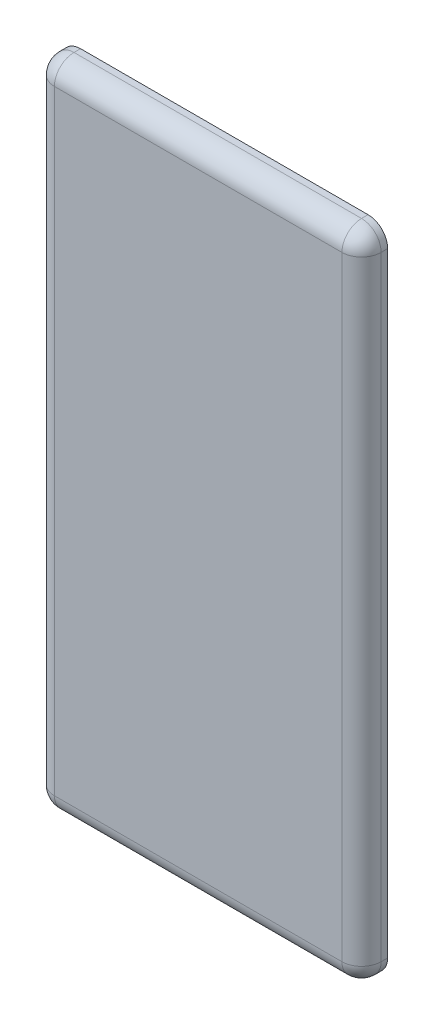
from build123d import *
from OCP.BRepFilletAPI import BRepFilletAPI_MakeChamfer

# Parameters (mm, degrees)
SKETCH1_W           = 50
SKETCH1_H           = 100
BOSS_EXTRUDE1_DEPTH = 4
FILLET1_R           = 3
FILLET2_R           = 3
SKETCH2_R           = 4.75
BOSS_EXTRUDE2_DEPTH = 10
CHAMFER1_SIZE       = 3
CHAMFER1_SIZE2      = 1.212078678


with BuildPart() as part:
    # Sketch1 → Boss-Extrude1 (new body)
    with BuildSketch(Plane.XY):
        Rectangle(SKETCH1_W, SKETCH1_H)
    extrude(amount=BOSS_EXTRUDE1_DEPTH)

    # Fillet1
    fillet1_edges = [part.edges().sort_by_distance(p)[0] for p in [
        (-25, 0, 4),
        (0, -50, 4),
        (25, 0, 4),
        (0, 50, 4),
    ]]
    fillet(fillet1_edges, radius=FILLET1_R)

    # Fillet2
    # the kernel refuses this fillet: 3 mm, written as the material it takes off along each edge
    with BuildSketch(Plane(origin=(-22, 47, 1), x_dir=(0, 1, 0), z_dir=(-1, 0, 0))) as fillet2_piece_1_section:
        Polygon((0, 0), (FILLET2_R, 0), (FILLET2_R, -FILLET2_R), (0, -FILLET2_R), align=None)
    fillet2_piece_1 = extrude(amount=FILLET2_R, mode=Mode.PRIVATE)
    fillet2_piece_1 = fillet2_piece_1 - Plane(origin=(-22, 47, 1), x_dir=(0, -0.7071067811865475, -0.7071067811865475), z_dir=(-1, 0, 0)) * Sphere(FILLET2_R, mode=Mode.PRIVATE)
    add(fillet2_piece_1, mode=Mode.SUBTRACT)
    with BuildSketch(Plane(origin=(22, 47, 1), x_dir=(0, 1, 0), z_dir=(1, 0, 0))) as fillet2_piece_2_section:
        Polygon((0, 0), (FILLET2_R, 0), (FILLET2_R, FILLET2_R), (0, FILLET2_R), align=None)
    fillet2_piece_2 = extrude(amount=FILLET2_R, mode=Mode.PRIVATE)
    fillet2_piece_2 = fillet2_piece_2 - Plane(origin=(22, 47, 1), x_dir=(0, -0.7071067811865475, -0.7071067811865475), z_dir=(1, 0, 0)) * Sphere(FILLET2_R, mode=Mode.PRIVATE)
    add(fillet2_piece_2, mode=Mode.SUBTRACT)
    with BuildSketch(Plane(origin=(-22, -47, 1), x_dir=(-1, 0, 0), z_dir=(0, -1, 0))) as fillet2_piece_3_section:
        Polygon((0, 0), (FILLET2_R, 0), (FILLET2_R, -FILLET2_R), (0, -FILLET2_R), align=None)
    fillet2_piece_3 = extrude(amount=FILLET2_R, mode=Mode.PRIVATE)
    fillet2_piece_3 = fillet2_piece_3 - Plane(origin=(-22, -47, 1), x_dir=(0.7071067811865475, 0, -0.7071067811865475), z_dir=(0, -1, 0)) * Sphere(FILLET2_R, mode=Mode.PRIVATE)
    add(fillet2_piece_3, mode=Mode.SUBTRACT)
    with BuildSketch(Plane(origin=(22, -47, 1), x_dir=(1, 0, 0), z_dir=(0, -1, 0))) as fillet2_piece_4_section:
        Polygon((0, 0), (FILLET2_R, 0), (FILLET2_R, FILLET2_R), (0, FILLET2_R), align=None)
    fillet2_piece_4 = extrude(amount=FILLET2_R, mode=Mode.PRIVATE)
    fillet2_piece_4 = fillet2_piece_4 - Plane(origin=(22, -47, 1), x_dir=(-0.7071067811865475, 0, -0.7071067811865475), z_dir=(0, -1, 0)) * Sphere(FILLET2_R, mode=Mode.PRIVATE)
    add(fillet2_piece_4, mode=Mode.SUBTRACT)
    with BuildSketch(Plane(origin=(25, -50, -7.5), x_dir=(-1, 0, 0), z_dir=(0, 0, 1)), Plane(origin=(25, 50, -7.5), x_dir=(0, -1, 0), z_dir=(0, 0, 1))) as fillet2_piece_5:
        with BuildLine():
            CenterArc((FILLET2_R, -FILLET2_R), FILLET2_R, 90, 90)
            Line((0, -FILLET2_R), (0, 0))
            Line((0, 0), (FILLET2_R, 0))
        make_face()
    extrude(amount=8.5, mode=Mode.SUBTRACT)
    with BuildSketch(Plane(origin=(-25, -50, -7.5), x_dir=(1, 0, 0), z_dir=(0, 0, 1)), Plane(origin=(-25, 50, -7.5), x_dir=(0, -1, 0), z_dir=(0, 0, 1))) as fillet2_piece_6:
        with BuildLine():
            CenterArc((FILLET2_R, FILLET2_R), FILLET2_R, 180, 90)
            Line((0, FILLET2_R), (0, 0))
            Line((0, 0), (FILLET2_R, 0))
        make_face()
    extrude(amount=8.5, mode=Mode.SUBTRACT)

    # Sketch2 → Boss-Extrude2 (add)
    with BuildSketch(Plane(origin=(0, 0, 0), x_dir=(-1, 0, 0), z_dir=(0, 0, -1))):
        with Locations((0, 25)):
            Circle(SKETCH2_R)
        with Locations((0, -25)):
            Circle(SKETCH2_R)
    extrude(amount=BOSS_EXTRUDE2_DEPTH)

    # Chamfer1: one chamfer whose edges measure the first distance from different faces: ONE call of the kernel's chamfer builder (chamfer() names one face for all edges)
    chamfer1_edges_1 = [part.edges().sort_by_distance(p)[0] for p in [
        (4.75, 25, -10),
    ]]
    chamfer1_side_1 = [part.faces().sort_by_distance(p)[0] for p in [
        (4.75, 25, -5),
    ]]
    chamfer1_edges_2 = [part.edges().sort_by_distance(p)[0] for p in [
        (4.75, -25, -10),
    ]]
    chamfer1_side_2 = [part.faces().sort_by_distance(p)[0] for p in [
        (4.75, -25, -5),
    ]]
    chamfer1 = BRepFilletAPI_MakeChamfer(part.part.solid().wrapped)
    for e in chamfer1_edges_1:
        chamfer1.Add(CHAMFER1_SIZE, CHAMFER1_SIZE2, e.wrapped, chamfer1_side_1[0].wrapped)  # the first distance lies on this face
    for e in chamfer1_edges_2:
        chamfer1.Add(CHAMFER1_SIZE, CHAMFER1_SIZE2, e.wrapped, chamfer1_side_2[0].wrapped)  # the first distance lies on this face
    add(Compound.cast(chamfer1.Shape()), mode=Mode.REPLACE)


solid = part.part
